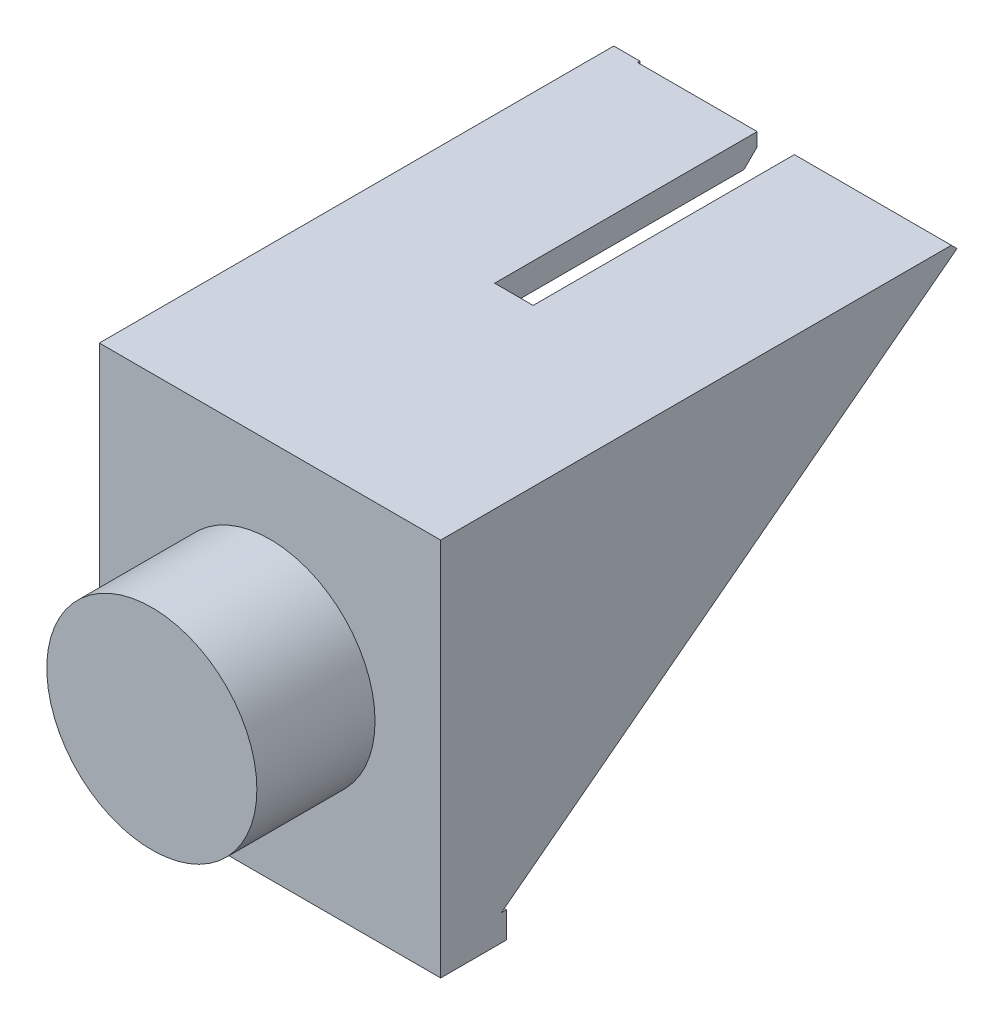
from build123d import *

# Parameters (mm, degrees)
SALIENTE_EXTRUIR1_DEPTH = 2
SALIENTE_EXTRUIR2_DEPTH = 2
SALIENTE_EXTRUIR3_DEPTH = 2
CROQUIS5_W              = 22
CROQUIS5_H              = 2
SALIENTE_EXTRUIR4_DEPTH = 17
CROQUIS6_W              = 26
CROQUIS6_H              = 2
SALIENTE_EXTRUIR5_DEPTH = 3
CROQUIS7_W              = 9.109165418
CROQUIS7_H              = 2
CROQUIS7_W_2            = 9.958756631
SALIENTE_EXTRUIR6_DEPTH = 20
CHAFL_N1_SIZE           = 1
CHAFL_N2_SIZE           = 1
CHAFL_N2_SIZE_2         = 0.713515305
CROQUIS8_R              = 8
SALIENTE_EXTRUIR7_DEPTH = 9


with BuildPart() as part:
    # Croquis1 → Saliente-Extruir1 (new body)
    with BuildSketch(Plane.XY):
        Polygon((-2, 23.6), (-2, 20.4), (-2, -5.284781413), (24, -5.284781413), (24, 20.4), (24, 23.6), align=None)
    extrude(amount=SALIENTE_EXTRUIR1_DEPTH)

    # Croquis2 → Saliente-Extruir2 (add)
    with BuildSketch(Plane(origin=(24, 0, 0), x_dir=(0, 0, -1), z_dir=(1, 0, 0))):
        Polygon((0, 23.6), (37.896029649, 23.6), (0, -5.284781413), align=None)
    extrude(amount=-SALIENTE_EXTRUIR2_DEPTH)

    # Croquis4 → Saliente-Extruir3 (add)
    with BuildSketch(Plane.ZY.offset(2)):
        with BuildLine():
            Line((-37.896029649, 23.6), (0, 23.6))
            Line((0, 23.6), (0, -5.284781413))
            Line((0, -5.284781413), (-9.534216457, 1.982305954))
            ThreePointArc((-9.534216457, 1.982305954), (-4.573867025, 12.209468647), (-13.454047634, 19.304700538))
            Line((-13.454047634, 19.304700538), (-32.260716249, 19.304700538))
            Line((-32.260716249, 19.304700538), (-37.896029649, 23.6))
        make_face()
    extrude(amount=-SALIENTE_EXTRUIR3_DEPTH)

    # Croquis5 → Saliente-Extruir4 (add)
    with BuildSketch(Plane(origin=(0, 0, 0), x_dir=(-1, 0, 0), z_dir=(0, 0, -1))):
        with Locations((-11, 22.6)):
            Rectangle(CROQUIS5_W, CROQUIS5_H)
    extrude(amount=SALIENTE_EXTRUIR4_DEPTH)

    # Croquis6 → Saliente-Extruir5 (add)
    with BuildSketch(Plane(origin=(0, 0, 0), x_dir=(-1, 0, 0), z_dir=(0, 0, -1))):
        with Locations((-11, -4.284781413)):
            Rectangle(CROQUIS6_W, CROQUIS6_H)
    extrude(amount=SALIENTE_EXTRUIR5_DEPTH)

    # Croquis7 → Saliente-Extruir6 (add)
    with BuildSketch(Plane(origin=(0, 0, -17), x_dir=(-1, 0, 0), z_dir=(0, 0, -1))):
        with Locations((-4.554582709, 22.6)):
            Rectangle(CROQUIS7_W, CROQUIS7_H)
        with Locations((-17.020621685, 22.6)):
            Rectangle(CROQUIS7_W_2, CROQUIS7_H)
    extrude(amount=SALIENTE_EXTRUIR6_DEPTH)

    # Chaflán1
    chafl_n1_edges = [part.edges().sort_by_distance(p)[0] for p in [
        (17.020621684, 21.6, -37),
        (4.554582709, 21.6, -37),
    ]]
    chamfer(chafl_n1_edges, length=CHAFL_N1_SIZE)

    # Chaflán2
    # the kernel refuses this chamfer: 1, 0.713515305 mm, written as the material it takes off along each edge
    with BuildSketch(Plane(origin=(26.571682988, 23.6, -37.896029649), x_dir=(0, 0, 1), z_dir=(-1, 0, 0))) as chafl_n2_piece_1:
        Polygon((CHAFL_N2_SIZE, 0), (CHAFL_N2_SIZE_2 * 0.79531418588, -CHAFL_N2_SIZE_2 * 0.606197446726), (0, 0), align=None)
    extrude(amount=7.143365976, mode=Mode.SUBTRACT)
    # the kernel refuses this chamfer: 1, 0.713515305 mm, written as the material it takes off along each edge
    with BuildSketch(Plane(origin=(22, 23.6, -37), x_dir=(0, 0, 1), z_dir=(-1, 0, 0))) as chafl_n2_2_piece_1_section:
        Polygon((CHAFL_N2_SIZE, 0), (0, -CHAFL_N2_SIZE), (0, 0), align=None)
    chafl_n2_2_piece_1 = extrude(amount=12.530439619, mode=Mode.PRIVATE)
    chafl_n2_2_piece_1 = split(chafl_n2_2_piece_1, bisect_by=Plane(origin=(22, 23.548014824, -36.948014824), z_dir=(-1.533293416683386e-15, 0.7071067811865533, -0.7071067811865418)), keep=Keep.TOP, mode=Mode.PRIVATE)
    add(chafl_n2_2_piece_1, mode=Mode.SUBTRACT)
    # the kernel refuses this chamfer: 1, 0.713515305 mm, written as the material it takes off along each edge
    with BuildSketch(Plane(origin=(-4.571682988, 23.6, -37.896029649), x_dir=(0, -0.6061974471264424, 0.7953141864052119), z_dir=(1, 0, 0))) as chafl_n2_3_piece_1:
        Polygon((CHAFL_N2_SIZE, 0), (CHAFL_N2_SIZE_2 * 0.79531418588, -CHAFL_N2_SIZE_2 * 0.606197446726), (0, 0), align=None)
    extrude(amount=7.143365976, mode=Mode.SUBTRACT)

    # Croquis8 → Saliente-Extruir7 (add)
    with BuildSketch(Plane.XY.offset(2)):
        with Locations((11, 9.157609293)):
            Circle(CROQUIS8_R)
    extrude(amount=SALIENTE_EXTRUIR7_DEPTH)


solid = part.part
